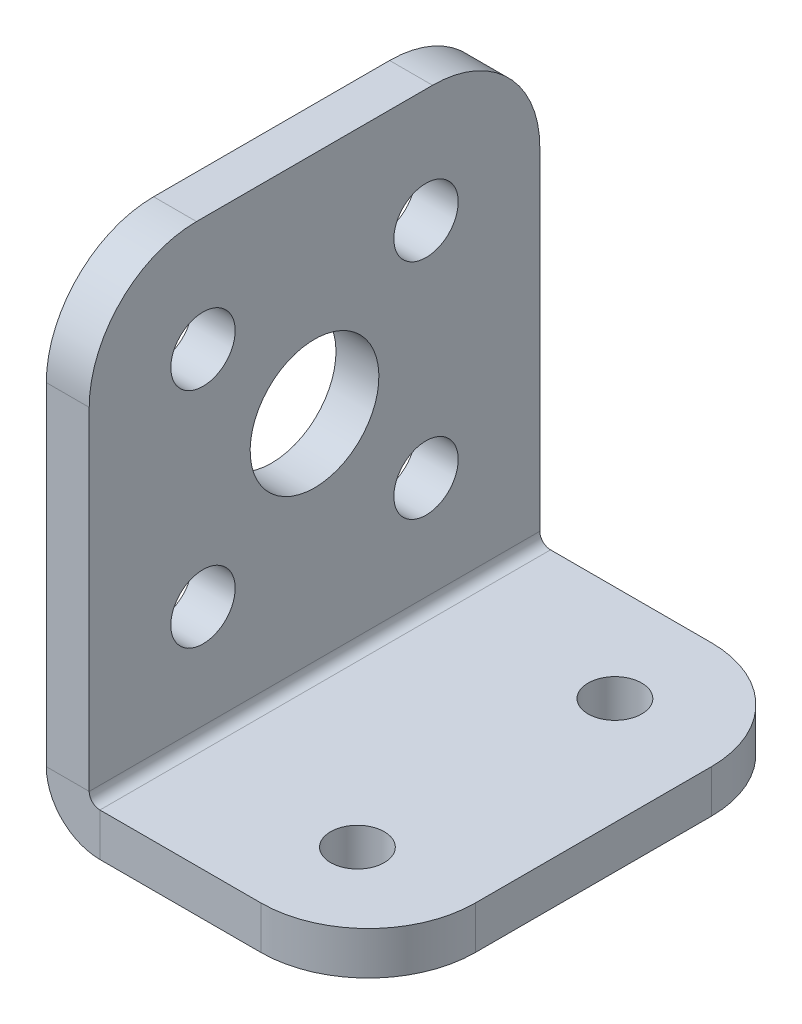
from build123d import *

# Parameters (mm, degrees)
CROQUIS_BASE_W         = 20.5
CROQUIS_BASE_H         = 21
BRIDA_BASE1_DEPTH      = 2
BRIDA_DE_ARISTA1_DEPTH = 21
CROQUIS11_R            = 3
CROQUIS11_R_2          = 1.5
CORTAR_EXTRUIR1_DEPTH  = 10
CROQUIS12_R            = 1.25
CORTAR_EXTRUIR2_DEPTH  = 2
REDONDEO1_R            = 5


# Sheet-metal steps are written as plain solids
with BuildPart() as part:
    # Croquis base → Brida base1 (new body)
    with BuildSketch(Plane(origin=(0, 0, 0), x_dir=(0, -1, 0), z_dir=(1, 0, 0))):
        Rectangle(CROQUIS_BASE_W, CROQUIS_BASE_H)
    extrude(amount=-BRIDA_BASE1_DEPTH)

    # Brida de arista1 section (across the edge) → Brida de arista1 (add)
    with BuildSketch(Plane(origin=(0, -10.75, 10.5), x_dir=(0, 1, 0), z_dir=(0, 0, -1))):
        with BuildLine():
            Line((-2, 0.5), (-2, 13))
            Line((-2, 13), (0, 13))
            Line((0, 13), (0, 0.5))
            ThreePointArc((0, 0.5), (0.146446609, 0.146446609), (0.5, 0))
            Line((0.5, 0), (0.5, -2))
            ThreePointArc((0.5, -2), (-1.267766953, -1.267766953), (-2, 0.5))
        make_face()
    extrude(amount=BRIDA_DE_ARISTA1_DEPTH)

    # Croquis11 → Cortar-Extruir1 (cut)
    with BuildSketch(Plane(origin=(-2, 0, 0), x_dir=(0, -1, 0), z_dir=(-1, 0, 0))):
        with Locations((0.25, 0)):
            Circle(CROQUIS11_R)
        with Locations((-4.947234842, 5.197234842)):
            Circle(CROQUIS11_R_2)
        with Locations((5.447234842, 5.197234842)):
            Circle(CROQUIS11_R_2)
        with Locations((5.447234842, -5.197234842)):
            Circle(CROQUIS11_R_2)
        with Locations((-4.947234842, -5.197234842)):
            Circle(CROQUIS11_R_2)
    extrude(amount=-CORTAR_EXTRUIR1_DEPTH, mode=Mode.SUBTRACT)

    # Croquis12 → Cortar-Extruir2 (cut)
    with BuildSketch(Plane(origin=(0, -12.75, 0), x_dir=(0, 0, -1), z_dir=(0, -1, 0))):
        with Locations(Location((6, 8, 0), (0, 0, 90))):
            Circle(CROQUIS12_R)
        with Locations(Location((-6, 8, 0), (0, 0, 270))):
            Circle(CROQUIS12_R)
    extrude(amount=-CORTAR_EXTRUIR2_DEPTH, mode=Mode.SUBTRACT)

    # Redondeo1
    redondeo1_edges = [part.edges().sort_by_distance(p)[0] for p in [
        (13, -11.75, 10.5),
        (13, -11.75, -10.5),
        (-1, 10.25, 10.5),
        (-1, 10.25, -10.5),
    ]]
    fillet(redondeo1_edges, radius=REDONDEO1_R)


solid = part.part
